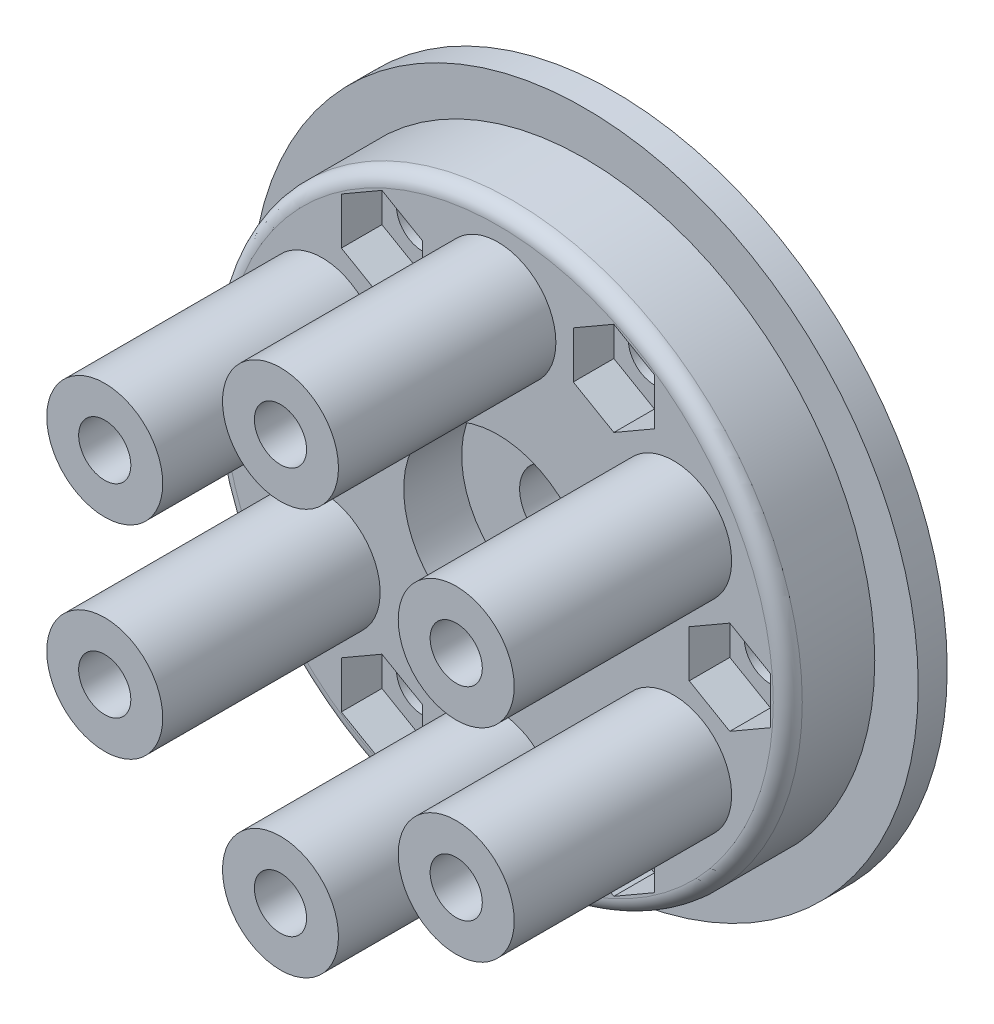
from build123d import *

# Parameters (mm, degrees)
SKETCH_1_R          = 4
EXTRUDE_1_DEPTH     = 20
EXTRUDE_1_2_DEPTH   = 20
EXTRUDE_1_3_DEPTH   = 20
EXTRUDE_1_4_DEPTH   = 20
EXTRUDE_1_5_DEPTH   = 20
EXTRUDE_1_6_DEPTH   = 20
SKETCH_2_R          = 20
EXTRUDE_2_DEPTH     = 6
SKETCH_3_R          = 1.8
CUT_EXTRUDE_1_DEPTH = 39.418745425
SKETCH_4_R          = 6.5
CUT_EXTRUDE_2_DEPTH = 35.641016151
SKETCH_5_R          = 23
SKETCH_5_R_2        = 20
EXTRUDE_3_DEPTH     = 2
CUT_EXTRUDE_START   = -5
SKETCH_7_R          = 4
CUT_EXTRUDE_3_DEPTH = 5
SKETCH_8_R          = 20
SKETCH_8_R_2        = 2.5
SKETCH_8_R_3        = 1.8
EXTRUDE_6_DEPTH     = 4
SKETCH_12_R         = 3
CUT_EXTRUDE_4_DEPTH = 3
CUT_EXTRUDE_5_DEPTH = 2.8
SKETCH_14_R         = 1.8
CUT_EXTRUDE_6_DEPTH = 38.078834933
SKETCH_15_R         = 20
SKETCH_15_R_2       = 2.5
SKETCH_15_R_3       = 3
SKETCH_15_R_4       = 1.8
EXTRUDE_7_DEPTH     = 1
SKETCH_16_R         = 3
SKETCH_16_R_2       = 1.8
EXTRUDE_8_DEPTH     = 1
EXTRUDE_START       = 4
SKETCH_17_R         = 23
SKETCH_17_R_2       = 20
EXTRUDE_9_DEPTH     = 2
CUT_EXTRUDE_START_2 = -2
SKETCH_18_R         = 23
SKETCH_18_R_2       = 20
CUT_EXTRUDE_7_DEPTH = 2
FILLET_3_R          = 1
EXTRUDE_START_2     = 2
SKETCH_19_R         = 6.5
SKETCH_19_R_2       = 2.5
EXTRUDE_10_DEPTH    = 2
SKETCH_21_R         = 20
CUT_EXTRUDE_8_DEPTH = 2
SKETCH_22_R         = 3
CUT_EXTRUDE_9_DEPTH = 2
FILLET_4_R          = 1


with BuildPart() as part:
    # 草图1 → 凸台-拉伸1 (new body)
    with BuildSketch(Plane.XY):
        with Locations((0, 14)):
            Circle(SKETCH_1_R)
    extrude(amount=EXTRUDE_1_DEPTH)



with BuildPart() as body_2:
    # 草图1 → Extrude 1 2 (new body)
    with BuildSketch(Plane.XY):
        with Locations((12.124355653, 7)):
            Circle(SKETCH_1_R)
    extrude(amount=EXTRUDE_1_2_DEPTH)


with BuildPart() as body_3:
    # 草图1 → Extrude 1 3 (new body)
    with BuildSketch(Plane.XY):
        with Locations((12.124355653, -7)):
            Circle(SKETCH_1_R)
    extrude(amount=EXTRUDE_1_3_DEPTH)


with BuildPart() as body_4:
    # 草图1 → Extrude 1 4 (new body)
    with BuildSketch(Plane.XY):
        with Locations((0, -14)):
            Circle(SKETCH_1_R)
    extrude(amount=EXTRUDE_1_4_DEPTH)


with BuildPart() as body_5:
    # 草图1 → Extrude 1 5 (new body)
    with BuildSketch(Plane.XY):
        with Locations((-12.124355653, -7)):
            Circle(SKETCH_1_R)
    extrude(amount=EXTRUDE_1_5_DEPTH)


with BuildPart() as body_6:
    # 草图1 → Extrude 1 6 (new body)
    with BuildSketch(Plane.XY):
        with Locations((-12.124355653, 7)):
            Circle(SKETCH_1_R)
    extrude(amount=EXTRUDE_1_6_DEPTH)


with BuildPart() as part_1:
    add(part.part)

    add(body_2.part)  # 凸台-拉伸2 merges body 2

    add(body_3.part)  # 凸台-拉伸2 merges body 3

    add(body_4.part)  # 凸台-拉伸2 merges body 4

    add(body_5.part)  # 凸台-拉伸2 merges body 5

    add(body_6.part)  # 凸台-拉伸2 merges body 6
    # 草图2 → 凸台-拉伸2 (add)
    with BuildSketch(Plane(origin=(0, 0, 0), x_dir=(-1, 0, 0), z_dir=(0, 0, -1))):
        Circle(SKETCH_2_R)
    extrude(amount=EXTRUDE_2_DEPTH)

    # 草图3 → 切除-拉伸1 (cut, through all)
    with BuildSketch(Plane.XY.offset(20)):
        with Locations((0, 14)):
            Circle(SKETCH_3_R)
        with Locations((12.124355653, 7)):
            Circle(SKETCH_3_R)
        with Locations((12.124355653, -7)):
            Circle(SKETCH_3_R)
        with Locations((0, -14)):
            Circle(SKETCH_3_R)
        with Locations((-12.124355653, -7)):
            Circle(SKETCH_3_R)
        with Locations((-12.124355653, 7)):
            Circle(SKETCH_3_R)
    extrude(amount=-CUT_EXTRUDE_1_DEPTH, mode=Mode.SUBTRACT)

    # 草图4 → 切除-拉伸2 (cut, through all)
    with BuildSketch(Plane.XY):
        Circle(SKETCH_4_R)
    extrude(amount=-CUT_EXTRUDE_2_DEPTH, mode=Mode.SUBTRACT)

    # 草图5 → 凸台-拉伸3 (add)
    with BuildSketch(Plane.XY):
        Circle(SKETCH_5_R)
        Circle(SKETCH_5_R_2, mode=Mode.SUBTRACT)
    extrude(amount=-EXTRUDE_3_DEPTH)

    # 草图7 → 切除-拉伸3 (cut)
    with BuildSketch(Plane.XY.offset(20).offset(CUT_EXTRUDE_START)):
        with Locations(Location((0, -14, 0), (0, 0, 180))):
            Circle(SKETCH_7_R)
        with Locations(Location((-12.124355653, -7, 0), (0, 0, 180))):
            Circle(SKETCH_7_R)
        with Locations(Location((-12.124355653, 7, 0), (0, 0, 180))):
            Circle(SKETCH_7_R)
        with Locations((0, 14)):
            Circle(SKETCH_7_R)
        with Locations(Location((12.124355653, 7, 0), (0, 0, 180))):
            Circle(SKETCH_7_R)
        with Locations(Location((12.124355653, -7, 0), (0, 0, 180))):
            Circle(SKETCH_7_R)
    extrude(amount=CUT_EXTRUDE_3_DEPTH, mode=Mode.SUBTRACT)

    # 草图8 → 凸台-拉伸6 (add)
    with BuildSketch(Plane(origin=(0, 0, -6), x_dir=(-1, 0, 0), z_dir=(0, 0, -1))):
        with Locations(Location((0, 0, 0), (0, 0, 180))):
            Circle(SKETCH_8_R)
        Circle(SKETCH_8_R_2, mode=Mode.SUBTRACT)
        with Locations(Location((12.124355653, 7, 0), (0, 0, 180))):
            Circle(SKETCH_8_R_3, mode=Mode.SUBTRACT)
        with Locations(Location((12.124355653, -7, 0), (0, 0, 180))):
            Circle(SKETCH_8_R_3, mode=Mode.SUBTRACT)
        with Locations(Location((0, -14, 0), (0, 0, 180))):
            Circle(SKETCH_8_R_3, mode=Mode.SUBTRACT)
        with Locations(Location((-12.124355653, -7, 0), (0, 0, 180))):
            Circle(SKETCH_8_R_3, mode=Mode.SUBTRACT)
        with Locations(Location((-12.124355653, 7, 0), (0, 0, 180))):
            Circle(SKETCH_8_R_3, mode=Mode.SUBTRACT)
        with Locations(Location((0, 14, 0), (0, 0, 180))):
            Circle(SKETCH_8_R_3, mode=Mode.SUBTRACT)
    extrude(amount=EXTRUDE_6_DEPTH)

    # 草图12 → 切除-拉伸4 (cut)
    with BuildSketch(Plane(origin=(0, 0, -10), x_dir=(-1, 0, 0), z_dir=(0, 0, -1))):
        with Locations((0, 14)):
            Circle(SKETCH_12_R)
        with Locations((12.124355653, 7)):
            Circle(SKETCH_12_R)
        with Locations((12.124355653, -7)):
            Circle(SKETCH_12_R)
        with Locations((0, -14)):
            Circle(SKETCH_12_R)
        with Locations((-12.124355653, -7)):
            Circle(SKETCH_12_R)
        with Locations((-12.124355653, 7)):
            Circle(SKETCH_12_R)
    extrude(amount=-CUT_EXTRUDE_4_DEPTH, mode=Mode.SUBTRACT)

    # 草图13 → 切除-拉伸5 (cut)
    with BuildSketch(Plane.XY):
        Polygon((16, 3.233161507), (13.2, 1.616580754), (13.2, -1.616580754), (16, -3.233161507), (18.8, -1.616580754), (18.8, 1.616580754), align=None)
        Polygon((10.8, -12.239825707), (8, -10.623244953), (5.2, -12.239825707), (5.2, -15.472987214), (8, -17.089567968), (10.8, -15.472987214), align=None)
        Polygon((-5.2, -15.472987214), (-5.2, -12.239825707), (-8, -10.623244953), (-10.8, -12.239825707), (-10.8, -15.472987214), (-8, -17.089567968), align=None)
        Polygon((-16, -3.233161507), (-13.2, -1.616580754), (-13.2, 1.616580754), (-16, 3.233161507), (-18.8, 1.616580754), (-18.8, -1.616580754), align=None)
        Polygon((-10.8, 12.239825707), (-8, 10.623244953), (-5.2, 12.239825707), (-5.2, 15.472987214), (-8, 17.089567968), (-10.8, 15.472987214), align=None)
        Polygon((5.2, 15.472987214), (5.2, 12.239825707), (8, 10.623244953), (10.8, 12.239825707), (10.8, 15.472987214), (8, 17.089567968), align=None)
    extrude(amount=-CUT_EXTRUDE_5_DEPTH, mode=Mode.SUBTRACT)

    # 草图14 → 切除-拉伸6 (cut, through all)
    with BuildSketch(Plane.XY.offset(-2.8)):
        with Locations((16, 0)):
            Circle(SKETCH_14_R)
        with Locations((8, -13.856406461)):
            Circle(SKETCH_14_R)
        with Locations((-8, -13.856406461)):
            Circle(SKETCH_14_R)
        with Locations((-16, 0)):
            Circle(SKETCH_14_R)
        with Locations((-8, 13.856406461)):
            Circle(SKETCH_14_R)
        with Locations((8, 13.856406461)):
            Circle(SKETCH_14_R)
    extrude(amount=-CUT_EXTRUDE_6_DEPTH, mode=Mode.SUBTRACT)

    # 草图15 → 凸台-拉伸7 (add)
    with BuildSketch(Plane(origin=(0, 0, -10), x_dir=(-1, 0, 0), z_dir=(0, 0, -1))):
        with Locations(Location((0, 0, 0), (0, 0, 180))):
            Circle(SKETCH_15_R)
        Circle(SKETCH_15_R_2, mode=Mode.SUBTRACT)
        with Locations((0, 14)):
            Circle(SKETCH_15_R_3, mode=Mode.SUBTRACT)
        with Locations(Location((-8, 13.856406461, 0), (0, 0, 180))):
            Circle(SKETCH_15_R_4, mode=Mode.SUBTRACT)
        with Locations(Location((8, 13.856406461, 0), (0, 0, 180))):
            Circle(SKETCH_15_R_4, mode=Mode.SUBTRACT)
        with Locations(Location((16, 0, 0), (0, 0, 180))):
            Circle(SKETCH_15_R_4, mode=Mode.SUBTRACT)
        with Locations(Location((8, -13.856406461, 0), (0, 0, 180))):
            Circle(SKETCH_15_R_4, mode=Mode.SUBTRACT)
        with Locations(Location((-8, -13.856406461, 0), (0, 0, 180))):
            Circle(SKETCH_15_R_4, mode=Mode.SUBTRACT)
        with Locations(Location((-16, 0, 0), (0, 0, 180))):
            Circle(SKETCH_15_R_4, mode=Mode.SUBTRACT)
        with Locations((12.124355653, 7)):
            Circle(SKETCH_15_R_3, mode=Mode.SUBTRACT)
        with Locations((12.124355653, -7)):
            Circle(SKETCH_15_R_3, mode=Mode.SUBTRACT)
        with Locations((0, -14)):
            Circle(SKETCH_15_R_3, mode=Mode.SUBTRACT)
        with Locations((-12.124355653, -7)):
            Circle(SKETCH_15_R_3, mode=Mode.SUBTRACT)
        with Locations((-12.124355653, 7)):
            Circle(SKETCH_15_R_3, mode=Mode.SUBTRACT)
    extrude(amount=EXTRUDE_7_DEPTH)

    # 草图16 → 凸台-拉伸8 (add)
    # profile 1 of 6: a face of its own
    with BuildSketch(Plane(origin=(0, 0, -7), x_dir=(-1, 0, 0), z_dir=(0, 0, -1))):
        with Locations((0, -14)):
            Circle(SKETCH_16_R)
        with Locations(Location((0, -14, 0), (0, 0, 180))):
            Circle(SKETCH_16_R_2, mode=Mode.SUBTRACT)
    # profile 2 of 6: a face of its own
    with BuildSketch(Plane(origin=(0, 0, -7), x_dir=(-1, 0, 0), z_dir=(0, 0, -1))):
        with Locations((-12.124355653, -7)):
            Circle(SKETCH_16_R)
        with Locations(Location((-12.124355653, -7, 0), (0, 0, 180))):
            Circle(SKETCH_16_R_2, mode=Mode.SUBTRACT)
    # profile 3 of 6: a face of its own
    with BuildSketch(Plane(origin=(0, 0, -7), x_dir=(-1, 0, 0), z_dir=(0, 0, -1))):
        with Locations((-12.124355653, 7)):
            Circle(SKETCH_16_R)
        with Locations(Location((-12.124355653, 7, 0), (0, 0, 180))):
            Circle(SKETCH_16_R_2, mode=Mode.SUBTRACT)
    # profile 4 of 6: a face of its own
    with BuildSketch(Plane(origin=(0, 0, -7), x_dir=(-1, 0, 0), z_dir=(0, 0, -1))):
        with Locations((0, 14)):
            Circle(SKETCH_16_R)
        with Locations(Location((0, 14, 0), (0, 0, 180))):
            Circle(SKETCH_16_R_2, mode=Mode.SUBTRACT)
    # profile 5 of 6: a face of its own
    with BuildSketch(Plane(origin=(0, 0, -7), x_dir=(-1, 0, 0), z_dir=(0, 0, -1))):
        with Locations((12.124355653, 7)):
            Circle(SKETCH_16_R)
        with Locations(Location((12.124355653, 7, 0), (0, 0, 180))):
            Circle(SKETCH_16_R_2, mode=Mode.SUBTRACT)
    # profile 6 of 6: a face of its own
    with BuildSketch(Plane(origin=(0, 0, -7), x_dir=(-1, 0, 0), z_dir=(0, 0, -1))):
        with Locations((12.124355653, -7)):
            Circle(SKETCH_16_R)
        with Locations(Location((12.124355653, -7, 0), (0, 0, 180))):
            Circle(SKETCH_16_R_2, mode=Mode.SUBTRACT)
    extrude(amount=EXTRUDE_8_DEPTH)

    # 草图17 → 凸台-拉伸9 (add)
    with BuildSketch(Plane(origin=(0, 0, -2), x_dir=(-1, 0, 0), z_dir=(0, 0, -1)).offset(EXTRUDE_START)):
        with Locations(Location((0, 0, 0), (0, 0, 180))):
            Circle(SKETCH_17_R)
        with Locations(Location((0, 0, 0), (0, 0, 180))):
            Circle(SKETCH_17_R_2, mode=Mode.SUBTRACT)
    extrude(amount=EXTRUDE_9_DEPTH)

    # 草图18 → 切除-拉伸7 (cut)
    with BuildSketch(Plane(origin=(0, 0, -2), x_dir=(-1, 0, 0), z_dir=(0, 0, -1)).offset(CUT_EXTRUDE_START_2)):
        Circle(SKETCH_18_R)
        Circle(SKETCH_18_R_2, mode=Mode.SUBTRACT)
    extrude(amount=CUT_EXTRUDE_7_DEPTH, mode=Mode.SUBTRACT)

    # 圆角3
    fillet_3_edges = [part_1.edges().sort_by_distance(p)[0] for p in [
        (20, 0, 0),
    ]]
    fillet(fillet_3_edges, radius=FILLET_3_R)

    # 草图19 → 凸台-拉伸10 (add)
    with BuildSketch(Plane.XY.offset(-6).offset(EXTRUDE_START_2)):
        Circle(SKETCH_19_R)
        Circle(SKETCH_19_R_2, mode=Mode.SUBTRACT)
    extrude(amount=-EXTRUDE_10_DEPTH)

    # 草图21 → 切除-拉伸8 (cut)
    with BuildSketch(Plane(origin=(0, 0, -11), x_dir=(-1, 0, 0), z_dir=(0, 0, -1)).offset(CUT_EXTRUDE_START_2)):
        Circle(SKETCH_21_R)
    extrude(amount=CUT_EXTRUDE_8_DEPTH, mode=Mode.SUBTRACT)

    # 草图22 → 切除-拉伸9 (cut)
    with BuildSketch(Plane(origin=(0, 0, -8), x_dir=(-1, 0, 0), z_dir=(0, 0, -1)).offset(CUT_EXTRUDE_START_2)):
        with Locations((0, 14)):
            Circle(SKETCH_22_R)
        with Locations((-12.124355653, 7)):
            Circle(SKETCH_22_R)
        with Locations((12.124355653, 7)):
            Circle(SKETCH_22_R)
        with Locations((12.124355653, -7)):
            Circle(SKETCH_22_R)
        with Locations((0, -14)):
            Circle(SKETCH_22_R)
        with Locations((-12.124355653, -7)):
            Circle(SKETCH_22_R)
    extrude(amount=CUT_EXTRUDE_9_DEPTH, mode=Mode.SUBTRACT)

    # 圆角4
    fillet_4_edges = [part_1.edges().sort_by_distance(p)[0] for p in [
        (-20, 0, -8),
    ]]
    fillet(fillet_4_edges, radius=FILLET_4_R - 0.0001)  # a hair under: the kernel refuses the full size


solid = part_1.part
